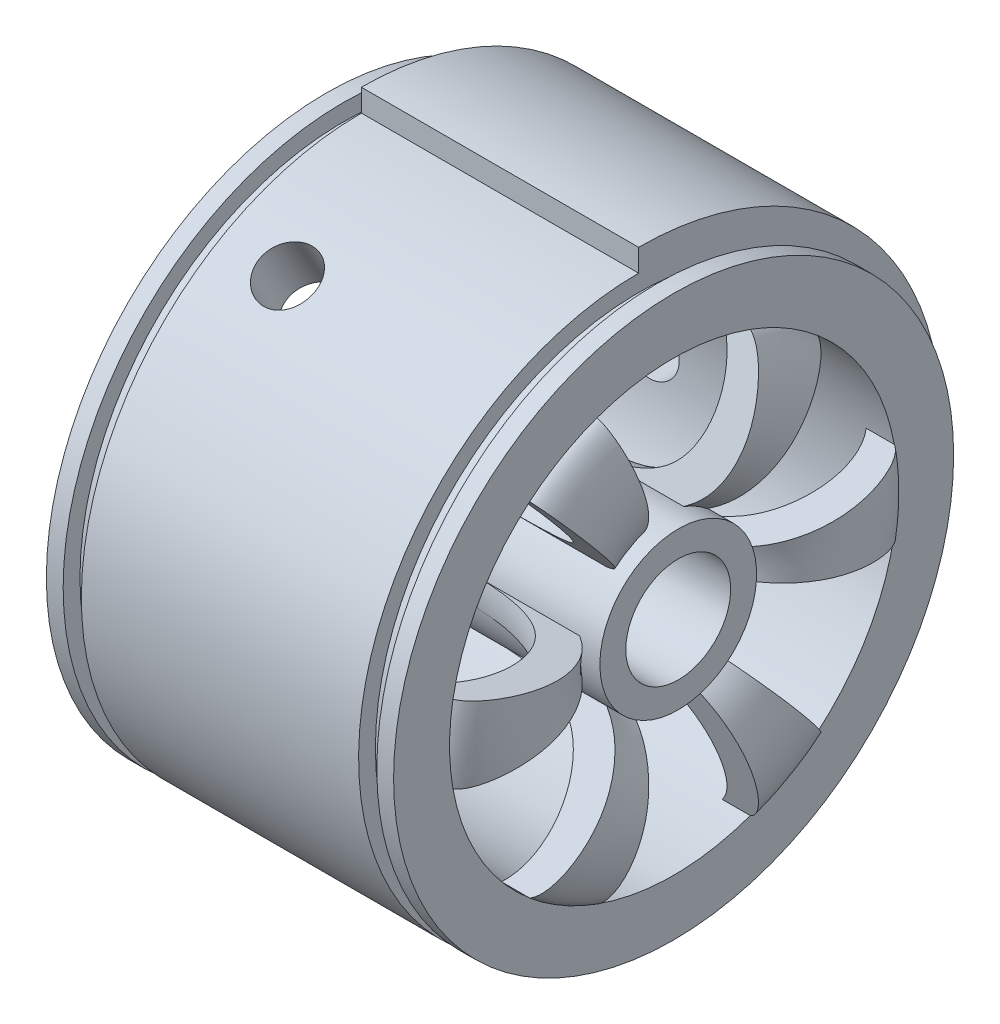
from build123d import *
from build123d.topology import SkipClean

# Parameters (mm, degrees)
SKETCH2_R           = 13.994994331
SKETCH2_R_2         = 9.362873653
BOSS_EXTRUDE1_DEPTH = 22
CUT_EXTRUDE1_DEPTH  = 97.836280036
CIRPATTERN1_COUNT   = 6
SKETCH5_R           = 5
CUT_EXTRUDE2_DEPTH  = 79.9701787
CIRPATTERN2_COUNT   = 3
SKETCH6_W           = 49.5
SKETCH6_H           = 4
REVOLVE2_ANGLE      = 80
BOSS_EXTRUDE2_START = 10
SKETCH8_R           = 9.362873653
BOSS_EXTRUDE2_DEPTH = 10


with BuildPart() as part:
    # Sketch1 → Revolve1 (revolve)
    with BuildSketch(Plane.XY):
        with BuildLine():
            Line((28, 50), (28, 47))
            Line((28, 47), (24.75, 47))
            Line((24.75, 47), (24.75, 50))
            Line((24.75, 50), (-24.75, 50))
            Line((-24.75, 50), (-24.75, 47))
            Line((-24.75, 47), (-28, 47))
            Line((-28, 47), (-28, 50))
            Line((-28, 50), (-31, 50))
            Line((-31, 50), (-31, 40))
            Line((-31, 40), (26, 40))
            add(Edge.make_bspline(
                [(26, 40), (30.773626393, 34.243876691), (29.458402495, 17.515745415), (16.165908902, 14.338363379), (10.585807217, 14.024234951), (9.824916614, 13.994994331)],
                knots=[0, 0, 0, 0, 0.466677859, 0.747183008, 0.791718054, 0.791718054, 0.791718054, 0.791718054], degree=3))
            Line((9.824916614, 13.994994331), (9.824916614, 9.362873653))
            add(Edge.make_bspline(
                [(31, 40), (33.56646726, 38.676126654), (37.029343512, 28.224770104), (31.178188537, 14.260765278), (20.484543501, 10.25375425), (12.49927781, 9.514565829), (9.824916614, 9.362873653)],
                knots=[0, 0, 0, 0, 0.28784554, 0.460109083, 0.693768031, 0.81880442, 0.81880442, 0.81880442, 0.81880442], degree=3))
            Line((31, 40), (31, 50))
            Line((31, 50), (28, 50))
        make_face()
    revolve(axis=Axis((0, 0, 0), (1, 0, 0)))

    # Sketch2 → Boss-Extrude1 (add)
    with BuildSketch(Plane.ZY.offset(-9.824916614)):
        Circle(SKETCH2_R)
        Circle(SKETCH2_R_2, mode=Mode.SUBTRACT)
    extrude(amount=-BOSS_EXTRUDE1_DEPTH)

    # Sketch4 → Cut-Extrude1 (cut, through all)
    with SkipClean():  # the faces are left unmerged after this step: merging them gives an invalid solid
        with BuildSketch(Plane.ZY.offset(31)):
            with BuildLine():
                Line((-4.786569967, 13.150992901), (-13.680805733, 37.587704831))
                ThreePointArc((-13.680805733, 37.587704831), (0, 40), (13.680805733, 37.587704831))
                Line((13.680805733, 37.587704831), (4.786569967, 13.150992901))
                ThreePointArc((4.786569967, 13.150992901), (0, 13.994994331), (-4.786569967, 13.150992901))
            make_face()
        cut_extrude1 = extrude(amount=-CUT_EXTRUDE1_DEPTH, mode=Mode.SUBTRACT)

    # CirPattern1: Cut-Extrude1 ×6 about axis
    with SkipClean():  # the faces are left unmerged after this step: merging them gives an invalid solid
        cirpattern1_axis = Axis((0, 0, 0), (-1, 0, 0))
        for i in range(1, CIRPATTERN1_COUNT):
            add(cut_extrude1.rotate(cirpattern1_axis, i * 360 / CIRPATTERN1_COUNT), mode=Mode.SUBTRACT)

    # Sketch5 → Cut-Extrude2 (cut, through all)
    with SkipClean():  # the faces are left unmerged after this step: merging them gives an invalid solid
        with BuildSketch(Plane.XY):
            with Locations((-13, 0)):
                Circle(SKETCH5_R)
        cut_extrude2 = extrude(amount=-CUT_EXTRUDE2_DEPTH, mode=Mode.SUBTRACT)

    # CirPattern2: Cut-Extrude2 ×3 about axis
    with SkipClean():  # the faces are left unmerged after this step: merging them gives an invalid solid
        cirpattern2_axis = Axis((0, 0, 0), (-1, 0, 0))
        for i in range(1, CIRPATTERN2_COUNT):
            add(cut_extrude2.rotate(cirpattern2_axis, i * 360 / CIRPATTERN2_COUNT), mode=Mode.SUBTRACT)

    # Sketch6 → Revolve2 (revolve)
    with SkipClean():  # the faces are left unmerged after this step: merging them gives an invalid solid
        with BuildSketch(Plane.XY):
            with Locations((0, 52)):
                Rectangle(SKETCH6_W, SKETCH6_H)
        revolve(axis=Axis((0, 0, 0), (-1, 0, 0)), revolution_arc=REVOLVE2_ANGLE)

    # Sketch8 → Boss-Extrude2 (add)
    with SkipClean():  # the faces are left unmerged after this step: merging them gives an invalid solid
        with BuildSketch(Plane.ZY.offset(-9.824916614).offset(BOSS_EXTRUDE2_START)):
            with BuildLine():
                ThreePointArc((4.786569967, 13.150992901), (0, 13.994994331), (-4.786569967, 13.150992901))
                ThreePointArc((-4.786569967, 13.150992901), (-6.997497166, 12.120020617), (-8.995808954, 10.720787639))
                ThreePointArc((-8.995808954, 10.720787639), (-12.120020617, 6.997497166), (-13.782378921, 2.430205262))
                ThreePointArc((-13.782378921, 2.430205262), (-13.994994331, 0), (-13.782378921, -2.430205262))
                ThreePointArc((-13.782378921, -2.430205262), (-12.120020617, -6.997497166), (-8.995808954, -10.720787639))
                ThreePointArc((-8.995808954, -10.720787639), (-6.997497166, -12.120020617), (-4.786569967, -13.150992901))
                ThreePointArc((-4.786569967, -13.150992901), (0, -13.994994331), (4.786569967, -13.150992901))
                ThreePointArc((4.786569967, -13.150992901), (6.997497166, -12.120020617), (8.995808954, -10.720787639))
                ThreePointArc((8.995808954, -10.720787639), (12.120020617, -6.997497166), (13.782378921, -2.430205262))
                ThreePointArc((13.782378921, -2.430205262), (13.994994331, 0), (13.782378921, 2.430205262))
                ThreePointArc((13.782378921, 2.430205262), (12.120020617, 6.997497166), (8.995808954, 10.720787639))
                ThreePointArc((8.995808954, 10.720787639), (6.997497166, 12.120020617), (4.786569967, 13.150992901))
            make_face()
            Circle(SKETCH8_R, mode=Mode.SUBTRACT)
        extrude(amount=-BOSS_EXTRUDE2_DEPTH)


solid = part.part
